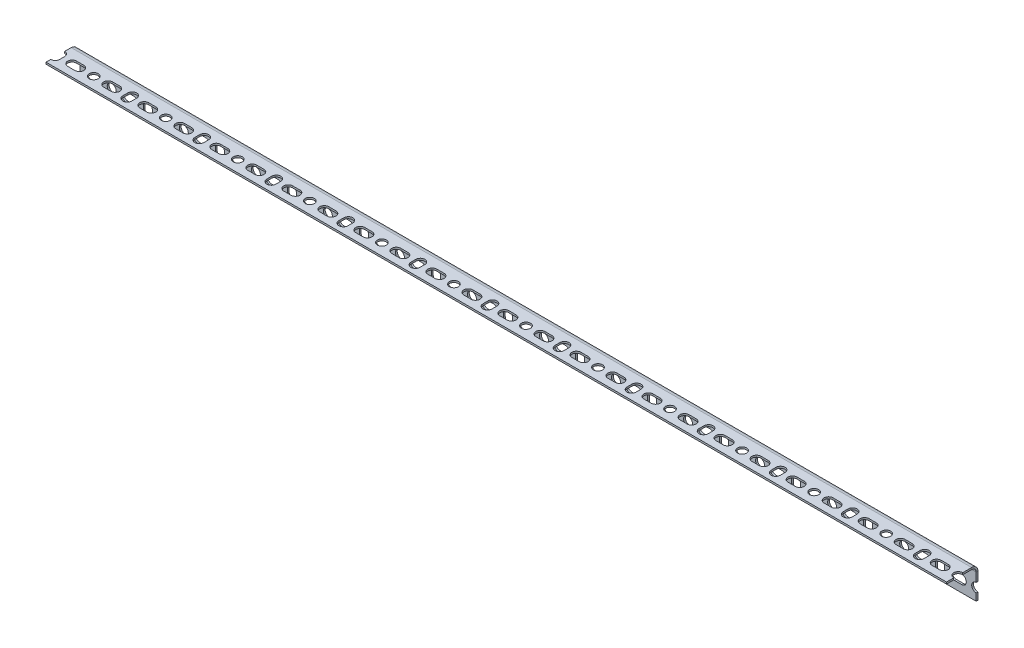
from build123d import *

# Parameters (mm, degrees)
SKETCH1_W                    = 1000
SKETCH1_H                    = 2
BASE_FLANGE1_DEPTH           = 35
EDGE_FLANGE1_STRIP_W         = 18
EDGE_FLANGE1_STRIP_H         = 2
EDGE_FLANGE1_STRIP_CUT_DEPTH = 1000
EDGE_FLANGE1_DEPTH           = 1000
SKETCH11_R                   = 5
CUT_EXTRUDE1_DEPTH           = 503.444026733
LPATTERN1_COUNT              = 14
LPATTERN1_PITCH              = 80
SKETCH12_R                   = 5
CUT_EXTRUDE2_DEPTH           = 35
LPATTERN2_COUNT              = 15
LPATTERN2_PITCH              = 80


# Sheet-metal steps are written as plain solids
with BuildPart() as part:
    # Sketch1 → Base-Flange1 (new body)
    with BuildSketch(Plane(origin=(0, 0, 0), x_dir=(1, 0, 0), z_dir=(0, 1, 0))):
        with Locations((0, -1)):
            Rectangle(SKETCH1_W, SKETCH1_H)
    extrude(amount=BASE_FLANGE1_DEPTH)

    # Edge-Flange1 strip (across the edge) → Edge-Flange1 strip cut (cut)
    with BuildSketch(Plane(origin=(500, 35, 2), x_dir=(0, -1, 0), z_dir=(-1, 0, 0))):
        with Locations((-2, -1)):
            Rectangle(EDGE_FLANGE1_STRIP_W, EDGE_FLANGE1_STRIP_H)
    extrude(amount=EDGE_FLANGE1_STRIP_CUT_DEPTH, mode=Mode.SUBTRACT)

    # Edge-Flange1 section (across the edge) → Edge-Flange1 (add)
    with BuildSketch(Plane(origin=(500, 35, 2), x_dir=(0, -1, 0), z_dir=(-1, 0, 0))):
        with BuildLine():
            Line((0, 5), (0, 33))
            Line((0, 33), (2, 33))
            Line((2, 33), (2, 5))
            ThreePointArc((2, 5), (3.464466094, 1.464466094), (7, 0))
            Line((7, 0), (7, -2))
            ThreePointArc((7, -2), (2.050252532, 0.050252532), (0, 5))
        make_face()
    extrude(amount=EDGE_FLANGE1_DEPTH)

    # Sketch11 → Cut-Extrude1 (cut, through all)
    with BuildSketch(Plane(origin=(0, 35, 0), x_dir=(1, 0, 0), z_dir=(0, 1, 0))):
        with Locations((500, -22)):
            Circle(SKETCH11_R)
        with BuildLine():
            Line((484, -27), (476, -27))
            ThreePointArc((476, -27), (471, -22), (476, -17))
            Line((476, -17), (484, -17))
            ThreePointArc((484, -17), (489, -22), (484, -27))
        make_face()
        with BuildLine():
            Line((444, -27), (436, -27))
            ThreePointArc((436, -27), (431, -22), (436, -17))
            Line((436, -17), (444, -17))
            ThreePointArc((444, -17), (449, -22), (444, -27))
        make_face()
        with BuildLine():
            Line((455, -24.75), (455, -19.25))
            ThreePointArc((455, -19.25), (460, -14.25), (465, -19.25))
            Line((465, -19.25), (465, -24.75))
            ThreePointArc((465, -24.75), (460, -29.75), (455, -24.75))
        make_face()
    cut_extrude1 = extrude(amount=-CUT_EXTRUDE1_DEPTH, mode=Mode.SUBTRACT)

    # LPattern1: Cut-Extrude1 ×14
    with Locations(*[(-i * LPATTERN1_PITCH, 0, 0) for i in range(1, LPATTERN1_COUNT)]):
        add(cut_extrude1, mode=Mode.SUBTRACT)

    # Sketch12 → Cut-Extrude2 (cut)
    with BuildSketch(Plane.XY.offset(2)):
        with Locations((500, 13)):
            Circle(SKETCH12_R)
        with BuildLine():
            Line((484, 8), (476, 8))
            ThreePointArc((476, 8), (471, 13), (476, 18))
            Line((476, 18), (484, 18))
            ThreePointArc((484, 18), (489, 13), (484, 8))
        make_face()
        with BuildLine():
            Line((455, 10.25), (455, 15.75))
            ThreePointArc((455, 15.75), (460, 20.75), (465, 15.75))
            Line((465, 15.75), (465, 10.25))
            ThreePointArc((465, 10.25), (460, 5.25), (455, 10.25))
        make_face()
        with BuildLine():
            Line((444, 8), (436, 8))
            ThreePointArc((436, 8), (431, 13), (436, 18))
            Line((436, 18), (444, 18))
            ThreePointArc((444, 18), (449, 13), (444, 8))
        make_face()
    cut_extrude2 = extrude(amount=-CUT_EXTRUDE2_DEPTH, mode=Mode.SUBTRACT)

    # LPattern2: Cut-Extrude2 ×15
    with Locations(*[(-i * LPATTERN2_PITCH, 0, 0) for i in range(1, LPATTERN2_COUNT)]):
        add(cut_extrude2, mode=Mode.SUBTRACT)


solid = part.part
